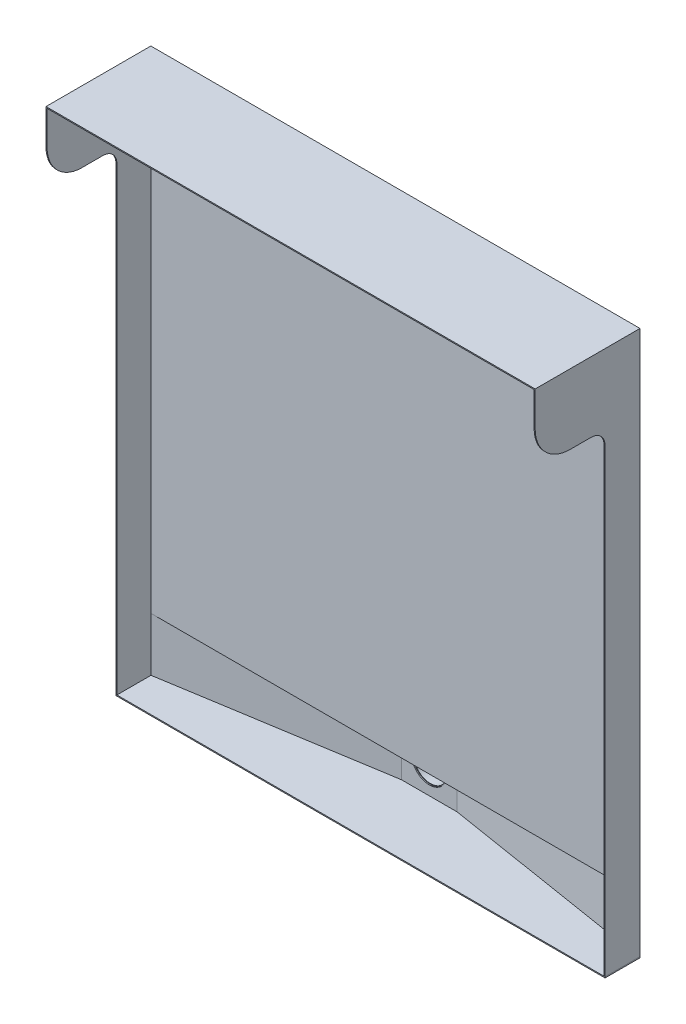
from build123d import *

# Parameters (mm, degrees)
SKETCH_6_W                 = 700
SKETCH_6_H                 = 780
EXTRUDE_2_DEPTH            = 150
EXTRUDE_4_DEPTH            = 80
SHELL_START                = -388.5
SHELL_2_OUTLINE_W          = 697
SHELL_2_OUTLINE_H          = 148.5
SHELL_2_DEPTH              = 777
SHELL_2_2_DEPTH            = 77
SKETCH_13_R                = 25
CUT_EXTRUDE_1_DEPTH        = 561.892146495
SPLIT_START                = -390
SPLIT_BODIES_5_DEPTH       = 1.5
SPLIT_BODIES_5_2_OUTLINE_W = 702
SPLIT_BODIES_5_2_OUTLINE_H = 203
SPLIT_BODIES_5_2_DEPTH     = 1.5
SKETCH_15_W                = 200.791070075
SKETCH_15_H                = 716.3886285
CUT_EXTRUDE_2_DEPTH        = 816.230028888
FILLET_1_R                 = 20
FILLET_2_R                 = 50
SKETCH_16_R                = 25
SKETCH_16_R_2              = 24
EXTRUDE_5_DEPTH            = 25


# Read off the part's stored shape, not the designer's step: 抽壳2, 分割5
with BuildPart() as part:
    # 草图6 → 凸台-拉伸2 (new body)
    with BuildSketch(Plane.XY):
        Rectangle(SKETCH_6_W, SKETCH_6_H)
    extrude(amount=EXTRUDE_2_DEPTH)

    # 草图8 → 凸台-拉伸4 (add)
    with BuildSketch(Plane.XZ.offset(390)):
        Polygon((-350, 0), (-40, -50), (40, -50), (350, 0), align=None)
    extrude(amount=-EXTRUDE_4_DEPTH)

    # 抽壳2 outline → 抽壳2 (cut)
    with BuildSketch(Plane(origin=(0, 0, 0), x_dir=(1, 0, 0), z_dir=(0, 1, 0)).offset(SHELL_START)):
        with Locations((0, -75.75)):
            Rectangle(SHELL_2_OUTLINE_W, SHELL_2_OUTLINE_H)
    extrude(amount=SHELL_2_DEPTH, mode=Mode.SUBTRACT)

    # Shell 2 2 outline → Shell 2 2 (cut)
    with BuildSketch(Plane(origin=(0, 0, 0), x_dir=(1, 0, 0), z_dir=(0, 1, 0)).offset(SHELL_START)):
        Polygon((-348.5, -1.5), (348.5, -1.5), (348.5, -1.277450174), (39.879808919, 48.5), (-39.879808919, 48.5), (-348.5, -1.277450174), align=None)
    extrude(amount=SHELL_2_2_DEPTH, mode=Mode.SUBTRACT)

    # 草图13 → 切除-拉伸1 (cut, through all)
    with BuildSketch(Plane(origin=(0, 0, -50), x_dir=(-1, 0, 0), z_dir=(0, 0, -1))):
        with Locations((0, -350)):
            Circle(SKETCH_13_R)
    extrude(amount=-CUT_EXTRUDE_1_DEPTH, mode=Mode.SUBTRACT)

    # Split Bodies 5 2 outline → Split Bodies 5 2 (cut)
    with BuildSketch(Plane(origin=(0, 0, 0), x_dir=(1, 0, 0), z_dir=(0, 1, 0)).offset(SPLIT_START)):
        with Locations((0, -49.5)):
            Rectangle(SPLIT_BODIES_5_2_OUTLINE_W, SPLIT_BODIES_5_2_OUTLINE_H)
    extrude(amount=SPLIT_BODIES_5_2_DEPTH, mode=Mode.SUBTRACT)


with BuildPart() as body_2:
    # Split Bodies 5 outline → Split Bodies 5 (new body)
    with BuildSketch(Plane(origin=(0, 0, 0), x_dir=(1, 0, 0), z_dir=(0, 1, 0)).offset(SPLIT_START)):
        Polygon((-350, -150), (350, -150), (350, 0), (40, 50), (-40, 50), (-350, 0), align=None)
    extrude(amount=SPLIT_BODIES_5_DEPTH)


with BuildPart() as cut_extrude_2_tool:
    # 草图15 → 切除-拉伸2 (new, through all)
    with BuildSketch(Plane.ZY.offset(350)):
        with Locations((150.395535037, -68.19431425)):
            Rectangle(SKETCH_15_W, SKETCH_15_H)
    extrude(amount=-CUT_EXTRUDE_2_DEPTH)


with BuildPart() as part_1:
    add(part.part)

    # 切除-拉伸2: cut by cut_extrude_2_tool
    add(cut_extrude_2_tool.part, mode=Mode.SUBTRACT)

    # 圆角1
    fillet_1_edges = [part_1.edges().sort_by_distance(p)[0] for p in [
        (-349.25, 290, 50),
        (349.25, 290, 50),
    ]]
    fillet(fillet_1_edges, radius=FILLET_1_R)

    # 圆角2
    fillet_2_edges = [part_1.edges().sort_by_distance(p)[0] for p in [
        (-349.25, 290, 150),
        (349.25, 290, 150),
    ]]
    fillet(fillet_2_edges, radius=FILLET_2_R)


with BuildPart() as body_2_1:
    add(body_2.part)

    # 切除-拉伸2: cut by cut_extrude_2_tool
    add(cut_extrude_2_tool.part, mode=Mode.SUBTRACT)


with BuildPart() as body_3:
    # 草图16 → 凸台-拉伸5 (new body)
    with BuildSketch(Plane(origin=(0, 0, -50), x_dir=(-1, 0, 0), z_dir=(0, 0, -1))):
        with Locations((0, -350)):
            Circle(SKETCH_16_R)
        with Locations((0, -350)):
            Circle(SKETCH_16_R_2, mode=Mode.SUBTRACT)
    extrude(amount=EXTRUDE_5_DEPTH)


solid = Compound([part_1.part, body_2_1.part, body_3.part])
